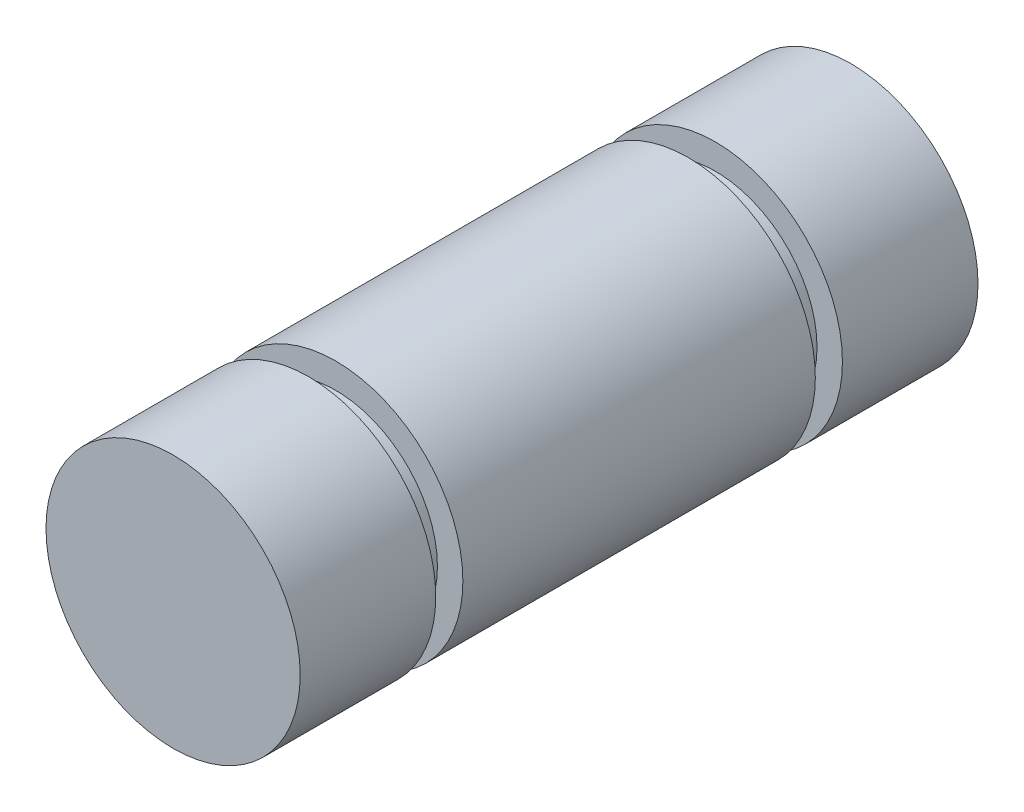
from build123d import *

# Parameters (mm, degrees)
SKETCH1_R           = 4.7625
BOSS_EXTRUDE1_DEPTH = 12.7
SKETCH2_W           = 0.9525
SKETCH2_H           = 1.016


with BuildPart() as part:
    # Sketch1 → Boss-Extrude1 (new, symmetric)
    with BuildSketch(Plane.XY):
        Circle(SKETCH1_R)
    extrude(amount=BOSS_EXTRUDE1_DEPTH, both=True)

    # Sketch2 → Cut-Revolve1 (revolve, cut)
    with BuildSketch(Plane(origin=(0, 0, 0), x_dir=(1, 0, 0), z_dir=(0, 1, 0))):
        with Locations((4.28625, 7.112)):
            Rectangle(SKETCH2_W, SKETCH2_H)
        with Locations((4.28625, -7.112)):
            Rectangle(SKETCH2_W, SKETCH2_H)
    revolve(axis=Axis((0, 0, 12.7), (0, 0, -1)), mode=Mode.SUBTRACT)


solid = part.part
